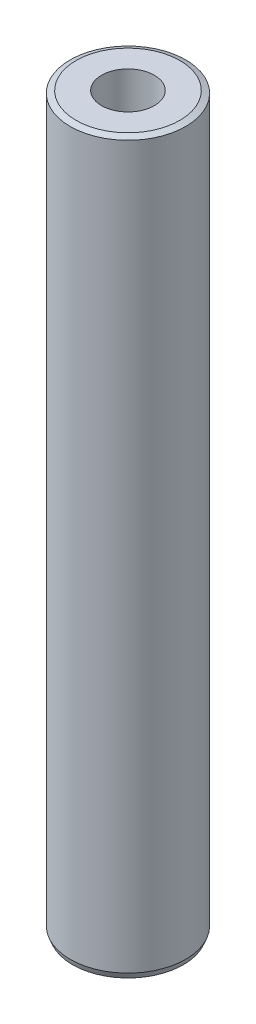
from build123d import *
from OCP.BRepFilletAPI import BRepFilletAPI_MakeChamfer

# Parameters (mm, degrees)
SKETCH1_R           = 47.5
BOSS_EXTRUDE1_DEPTH = 600
SKETCH2_R           = 21.702912212
CUT_EXTRUDE1_DEPTH  = 604.748706003
CHAMFER1_SIZE       = 1.928727719
CHAMFER1_SIZE2      = 4.838876656


with BuildPart() as part:
    # Sketch1 → Boss-Extrude1 (new body)
    with BuildSketch(Plane(origin=(0, 0, 0), x_dir=(1, 0, 0), z_dir=(0, 1, 0))):
        Circle(SKETCH1_R)
    extrude(amount=BOSS_EXTRUDE1_DEPTH)

    # Sketch2 → Cut-Extrude1 (cut, through all)
    with BuildSketch(Plane(origin=(0, 0, 0), x_dir=(1, 0, 0), z_dir=(0, 1, 0))):
        Circle(SKETCH2_R)
    extrude(amount=CUT_EXTRUDE1_DEPTH, mode=Mode.SUBTRACT)

    # Chamfer1: one chamfer whose edges measure the first distance from different faces: ONE call of the kernel's chamfer builder (chamfer() names one face for all edges)
    chamfer1_edges_1 = [part.edges().sort_by_distance(p)[0] for p in [
        (-47.5, 600, 0),
    ]]
    chamfer1_side_1 = [part.faces().sort_by_distance(p)[0] for p in [
        (-47.5, 300, 0),
    ]]
    chamfer1_edges_2 = [part.edges().sort_by_distance(p)[0] for p in [
        (-47.5, 0, 0),
    ]]
    chamfer1_side_2 = [part.faces().sort_by_distance(p)[0] for p in [
        (-46.156497116, 0, 0),
    ]]
    chamfer1 = BRepFilletAPI_MakeChamfer(part.part.solid().wrapped)
    for e in chamfer1_edges_1:
        chamfer1.Add(CHAMFER1_SIZE, CHAMFER1_SIZE2, e.wrapped, chamfer1_side_1[0].wrapped)  # the first distance lies on this face
    for e in chamfer1_edges_2:
        chamfer1.Add(CHAMFER1_SIZE, CHAMFER1_SIZE2, e.wrapped, chamfer1_side_2[0].wrapped)  # the first distance lies on this face
    add(Compound.cast(chamfer1.Shape()), mode=Mode.REPLACE)


solid = part.part
